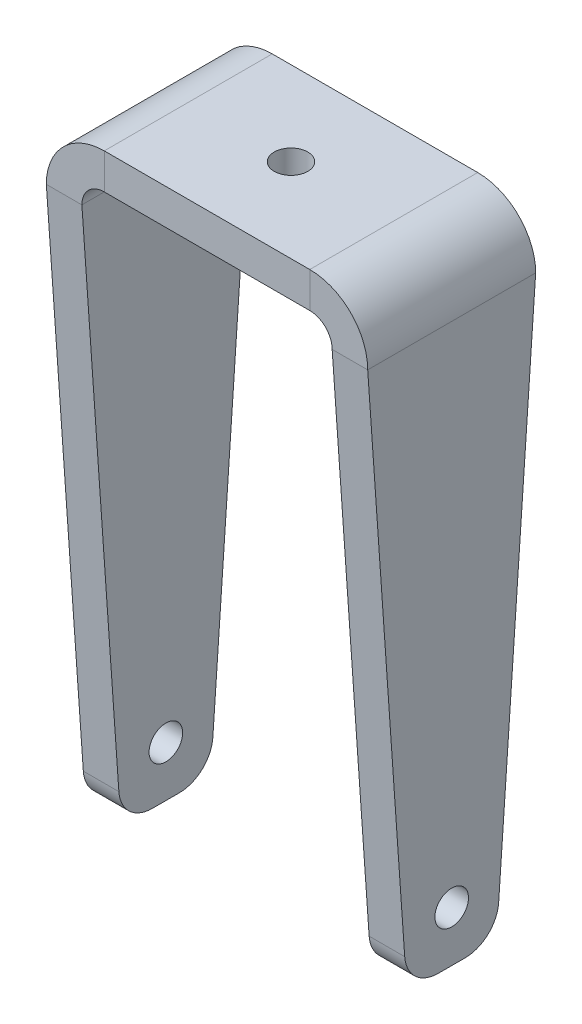
from build123d import *

# Parameters (mm, degrees)
SKETCH8_W                    = 28.7
SKETCH8_H                    = 15
BASE_FLANGE1_DEPTH           = 3.175
EDGE_FLANGE1_STRIP_W         = 16.7
EDGE_FLANGE1_STRIP_H         = 3.175
EDGE_FLANGE1_STRIP_CUT_DEPTH = 15
EDGE_FLANGE1_DEPTH           = 15
EDGE_FLANGE2_STRIP_W         = 16.7
EDGE_FLANGE2_STRIP_H         = 3.175
EDGE_FLANGE2_STRIP_CUT_DEPTH = 15
EDGE_FLANGE2_DEPTH           = 15
SKETCH19_R                   = 1.5
CUT_EXTRUDE1_DEPTH           = 10
CUT_EXTRUDE2_DEPTH           = 64.825465137
CUT_EXTRUDE2_DEPTH_BACK      = 64.825465137
CUT_EXTRUDE3_DEPTH           = 64.825465137
CUT_EXTRUDE3_DEPTH_BACK      = 64.825465137
SKETCH21_R                   = 1.5
FILLET1_R                    = 3


# Sheet-metal steps are written as plain solids
with BuildPart() as part:
    # Sketch8 → Base-Flange1 (new body)
    with BuildSketch(Plane(origin=(0, 0, 0), x_dir=(1, 0, 0), z_dir=(0, 1, 0))):
        with Locations((0, 7.5)):
            Rectangle(SKETCH8_W, SKETCH8_H)
    extrude(amount=-BASE_FLANGE1_DEPTH)

    # Edge-Flange1 strip (across the edge) → Edge-Flange1 strip cut (cut)
    with BuildSketch(Plane(origin=(14.35, -3.175, -15), x_dir=(-1, 0, 0), z_dir=(0, 0, 1))):
        with Locations((-3.175, -1.5875)):
            Rectangle(EDGE_FLANGE1_STRIP_W, EDGE_FLANGE1_STRIP_H)
    extrude(amount=EDGE_FLANGE1_STRIP_CUT_DEPTH, mode=Mode.SUBTRACT)

    # Edge-Flange1 section (across the edge) → Edge-Flange1 (add)
    with BuildSketch(Plane(origin=(14.35, -3.175, -15), x_dir=(-1, 0, 0), z_dir=(0, 0, 1))):
        with BuildLine():
            Line((0, 2), (0, 51.825))
            Line((0, 51.825), (3.175, 51.825))
            Line((3.175, 51.825), (3.175, 2))
            ThreePointArc((3.175, 2), (3.760786438, 0.585786438), (5.175, 0))
            Line((5.175, 0), (5.175, -3.175))
            ThreePointArc((5.175, -3.175), (1.515722407, -1.659277593), (0, 2))
        make_face()
    extrude(amount=EDGE_FLANGE1_DEPTH)

    # Edge-Flange2 strip (across the edge) → Edge-Flange2 strip cut (cut)
    with BuildSketch(Plane(origin=(-14.35, -3.175, 0), x_dir=(1, 0, 0), z_dir=(0, 0, -1))):
        with Locations((-3.175, -1.5875)):
            Rectangle(EDGE_FLANGE2_STRIP_W, EDGE_FLANGE2_STRIP_H)
    extrude(amount=EDGE_FLANGE2_STRIP_CUT_DEPTH, mode=Mode.SUBTRACT)

    # Edge-Flange2 section (across the edge) → Edge-Flange2 (add)
    with BuildSketch(Plane(origin=(-14.35, -3.175, 0), x_dir=(1, 0, 0), z_dir=(0, 0, -1))):
        with BuildLine():
            Line((0, 2), (0, 51.825))
            Line((0, 51.825), (3.175, 51.825))
            Line((3.175, 51.825), (3.175, 2))
            ThreePointArc((3.175, 2), (3.760786438, 0.585786438), (5.175, 0))
            Line((5.175, 0), (5.175, -3.175))
            ThreePointArc((5.175, -3.175), (1.515722407, -1.659277593), (0, 2))
        make_face()
    extrude(amount=EDGE_FLANGE2_DEPTH)

    # Sketch19 → Cut-Extrude1 (cut)
    with BuildSketch(Plane(origin=(0, 0, 0), x_dir=(1, 0, 0), z_dir=(0, 1, 0))):
        with Locations(Location((0, 7.5, 0), (0, 0, 270))):
            Circle(SKETCH19_R)
    extrude(amount=-CUT_EXTRUDE1_DEPTH, mode=Mode.SUBTRACT)

    # Sketch20 → Cut-Extrude2 (cut, two sides: drawn at the far end of the back side and taken through both)
    with BuildSketch(Plane(origin=(14.35, 0, 0), x_dir=(0, 0, -1), z_dir=(1, 0, 0)).offset(-CUT_EXTRUDE2_DEPTH_BACK)):
        Polygon((11.5, -55), (15, -5.175), (15, -55), align=None)
        Polygon((3.5, -55), (0, -5.175), (0, -55), align=None)
    extrude(amount=CUT_EXTRUDE2_DEPTH + CUT_EXTRUDE2_DEPTH_BACK, mode=Mode.SUBTRACT)

    # Sketch21 → Cut-Extrude3 (cut, two sides: drawn at the far end of the back side and taken through both)
    with BuildSketch(Plane(origin=(14.35, 0, 0), x_dir=(0, 0, -1), z_dir=(1, 0, 0)).offset(-CUT_EXTRUDE3_DEPTH_BACK)):
        with Locations(Location((7.5, -50.5, 0), (0, 0, 90))):
            Circle(SKETCH21_R)
    extrude(amount=CUT_EXTRUDE3_DEPTH + CUT_EXTRUDE3_DEPTH_BACK, mode=Mode.SUBTRACT)

    # Fillet1
    fillet1_edges = [part.edges().sort_by_distance(p)[0] for p in [
        (12.7625, -55, -3.5),
        (12.7625, -55, -11.5),
        (-12.7625, -55, -3.5),
        (-12.7625, -55, -11.5),
    ]]
    fillet(fillet1_edges, radius=FILLET1_R)


solid = part.part
